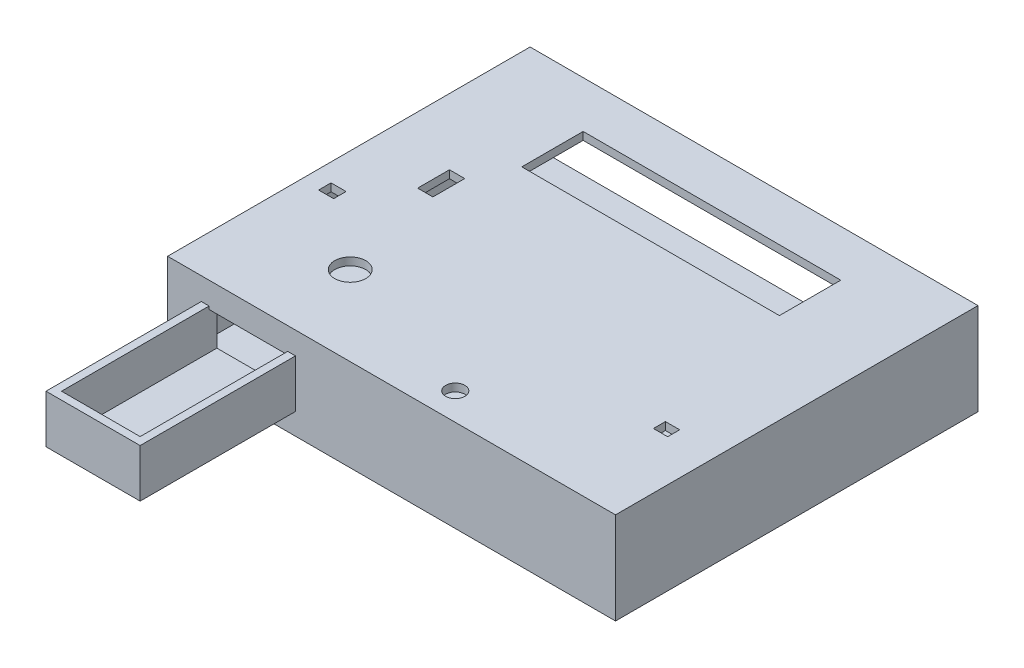
from build123d import *

# Parameters (mm, degrees)
SKETCH1_W           = 173
SKETCH1_H           = 35.519872746
BOSS_EXTRUDE2_DEPTH = 140
SHELL3_T            = -3
SKETCH3_R           = 6
SKETCH3_R_2         = 3.7
SKETCH3_W           = 99.5
SKETCH3_H           = 23.7
SKETCH3_W_2         = 5.9
SKETCH3_H_2         = 12.3
SKETCH3_W_3         = 5.800374035
SKETCH3_H_3         = 4.8
SKETCH3_W_4         = 5.5
SKETCH3_H_4         = 4.647872836
CUT_EXTRUDE3_DEPTH  = 7.5
SKETCH5_W           = 36.361516307
SKETCH5_H           = 18.595843956
BOSS_EXTRUDE4_DEPTH = 60
SHELL5_START        = 140
SHELL5_OUTLINE_W    = 30.361516307
SHELL5_OUTLINE_H    = 15.595843956
SHELL5_DEPTH        = 57
SKETCH8_W           = 30.361516307
SKETCH8_H           = 14.422474908
CUT_EXTRUDE6_DEPTH  = 20.5


# Read off the part's stored shape, not the designer's step: Shell5
with BuildPart() as part:
    # Sketch1 → Boss-Extrude2 (new body)
    with BuildSketch(Plane.XY):
        with Locations((86.5, 17.759936373)):
            Rectangle(SKETCH1_W, SKETCH1_H)
    extrude(amount=BOSS_EXTRUDE2_DEPTH)

    # Shell3
    shell3_openings = [part.faces().sort_by_distance(p)[0] for p in [
        (86.5, 17.759936373, 0),
    ]]
    offset(amount=SHELL3_T, openings=shell3_openings, kind=Kind.INTERSECTION)

    # Sketch3 → Cut-Extrude3 (cut)
    with BuildSketch(Plane(origin=(0, 35.519872746, 0), x_dir=(1, 0, 0), z_dir=(0, 1, 0))):
        with Locations(Location((39.736956851, -109.200672262, 0), (0, 0, 270))):
            Circle(SKETCH3_R)
        with Locations(Location((100.567495644, -129.464431968, 0), (0, 0, 270))):
            Circle(SKETCH3_R_2)
        with Locations((88.25, -29.85)):
            Rectangle(SKETCH3_W, SKETCH3_H)
        with Locations((28.45, -62.785125048)):
            Rectangle(SKETCH3_W_2, SKETCH3_H_2)
        with Locations((9.910075314, -86.290425048)):
            Rectangle(SKETCH3_W_3, SKETCH3_H_3)
        with Locations((154.184914317, -101.481582974)):
            Rectangle(SKETCH3_W_4, SKETCH3_H_4)
    extrude(amount=-CUT_EXTRUDE3_DEPTH, mode=Mode.SUBTRACT)

    # Sketch5 → Boss-Extrude4 (add)
    with BuildSketch(Plane.XY.offset(140)):
        with Locations((31.210571096, 17.593902052)):
            Rectangle(SKETCH5_W, SKETCH5_H)
    extrude(amount=BOSS_EXTRUDE4_DEPTH)

    # Shell5 outline → Shell5 (cut)
    with BuildSketch(Plane.XY.offset(SHELL5_START)):
        with Locations((31.210571096, 19.093902052)):
            Rectangle(SHELL5_OUTLINE_W, SHELL5_OUTLINE_H)
    extrude(amount=SHELL5_DEPTH, mode=Mode.SUBTRACT)

    # Sketch8 → Cut-Extrude6 (cut)
    with BuildSketch(Plane.XY.offset(140)):
        with Locations((31.210571096, 18.507217528)):
            Rectangle(SKETCH8_W, SKETCH8_H)
    extrude(amount=-CUT_EXTRUDE6_DEPTH, mode=Mode.SUBTRACT)


solid = part.part
